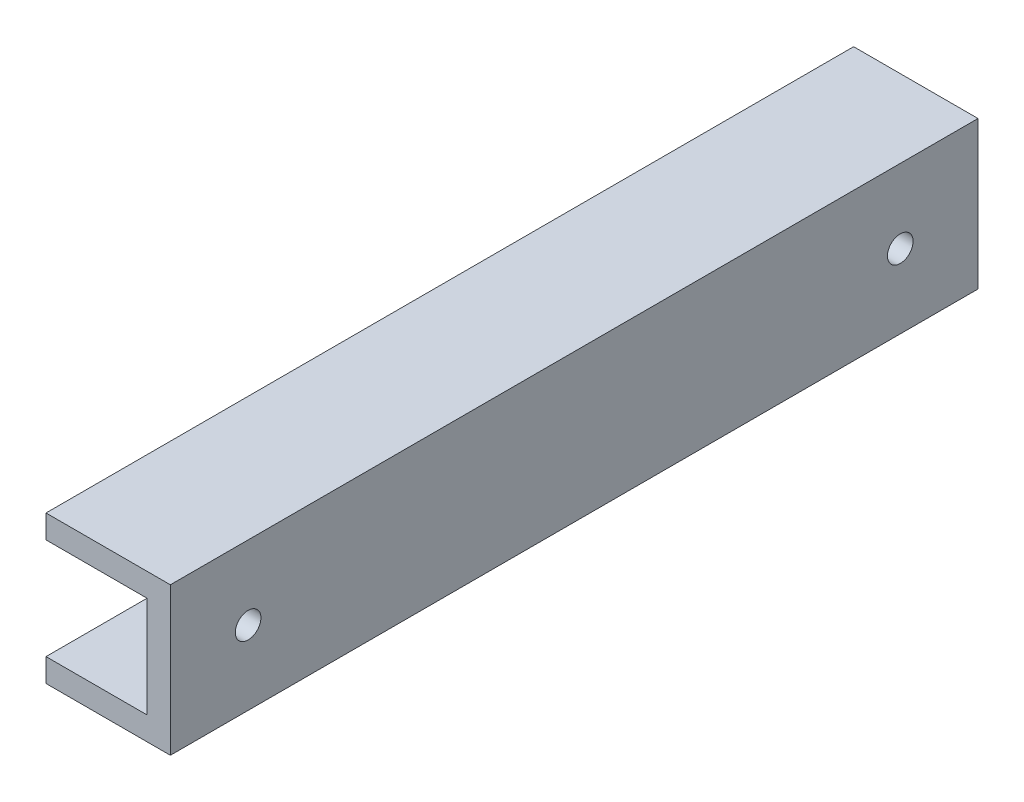
from build123d import *

# Parameters (mm, degrees)
SKETCH_1_W          = 19
SKETCH_1_H          = 19
SKETCH_1_W_2        = 13
SKETCH_1_H_2        = 13
EXTRUDE_1_DEPTH     = 103.9
SKETCH_2_R          = 1.65
CUT_EXTRUDE_1_DEPTH = 30
SKETCH_3_W          = 116.915177823
SKETCH_3_H          = 46.219516436
CUT_EXTRUDE_2_DEPTH = 3
SKETCH_4_W          = 5
SKETCH_4_H          = 13
EXTRUDE_1_2_DEPTH   = 10
SKETCH_5_W          = 47.9
SKETCH_5_H          = 5
EXTRUDE_2_DEPTH     = 10
SKETCH_6_W          = 57.9
SKETCH_6_H          = 13
EXTRUDE_3_DEPTH     = 10
SKETCH_8_W          = 57.9
SKETCH_8_H          = 5
CUT_EXTRUDE_3_DEPTH = 3
CHAMFER_1_SIZE      = 3
CHAMFER_2_SIZE      = 4


with BuildPart() as part:
    # 草图1 → Extrude 1 (new body)
    with BuildSketch(Plane.XY):
        with Locations((6.5, 6.5)):
            Rectangle(SKETCH_1_W, SKETCH_1_H)
        with Locations((6.5, 6.5)):
            Rectangle(SKETCH_1_W_2, SKETCH_1_H_2, mode=Mode.SUBTRACT)
    extrude(amount=EXTRUDE_1_DEPTH)

    # 草图2 → 切除-拉伸1 (cut)
    with BuildSketch(Plane.ZY.offset(3)):
        with Locations((10, 6.5)):
            Circle(SKETCH_2_R)
        with Locations((93.9, 6.5)):
            Circle(SKETCH_2_R)
    extrude(amount=-CUT_EXTRUDE_1_DEPTH, mode=Mode.SUBTRACT)

    # 草图3 → 切除-拉伸2 (cut)
    with BuildSketch(Plane.ZY.offset(3)):
        with Locations((53.162237228, 0.202739406)):
            Rectangle(SKETCH_3_W, SKETCH_3_H)
    extrude(amount=-CUT_EXTRUDE_2_DEPTH, mode=Mode.SUBTRACT)

    # 草图4 → Extrude 1 2 (add)
    with BuildSketch(Plane.ZY.offset(-13)):
        with Locations((25.5, 6.5)):
            Rectangle(SKETCH_4_W, SKETCH_4_H)
        with Locations((78.4, 6.5)):
            Rectangle(SKETCH_4_W, SKETCH_4_H)
    extrude(amount=EXTRUDE_1_2_DEPTH)

    # 草图5 → 凸台-拉伸2 (add)
    with BuildSketch(Plane.ZY.offset(-13)):
        with Locations((51.95, 6.5)):
            Rectangle(SKETCH_5_W, SKETCH_5_H)
    extrude(amount=EXTRUDE_2_DEPTH)

    # 草图6 → 凸台-拉伸3 (add)
    with BuildSketch(Plane.ZY.offset(-13)):
        with Locations((51.95, 6.5)):
            Rectangle(SKETCH_6_W, SKETCH_6_H)
    extrude(amount=EXTRUDE_3_DEPTH)

    # 草图8 → 切除-拉伸3 (cut)
    with BuildSketch(Plane.ZY.offset(-3)):
        with Locations((51.95, 6.5)):
            Rectangle(SKETCH_8_W, SKETCH_8_H)
    extrude(amount=-CUT_EXTRUDE_3_DEPTH, mode=Mode.SUBTRACT)

    # 倒角1
    chamfer_1_edges = [part.edges().sort_by_distance(p)[0] for p in [
        (6, 6.5, 23),
        (6, 6.5, 80.9),
    ]]
    chamfer(chamfer_1_edges, length=CHAMFER_1_SIZE)

    # 倒角2
    chamfer_2_edges = [part.edges().sort_by_distance(p)[0] for p in [
        (13, 6.5, 23),
        (13, 6.5, 80.9),
    ]]
    chamfer(chamfer_2_edges, length=CHAMFER_2_SIZE - 0.0001)  # a hair under: the kernel refuses the full size


solid = part.part
